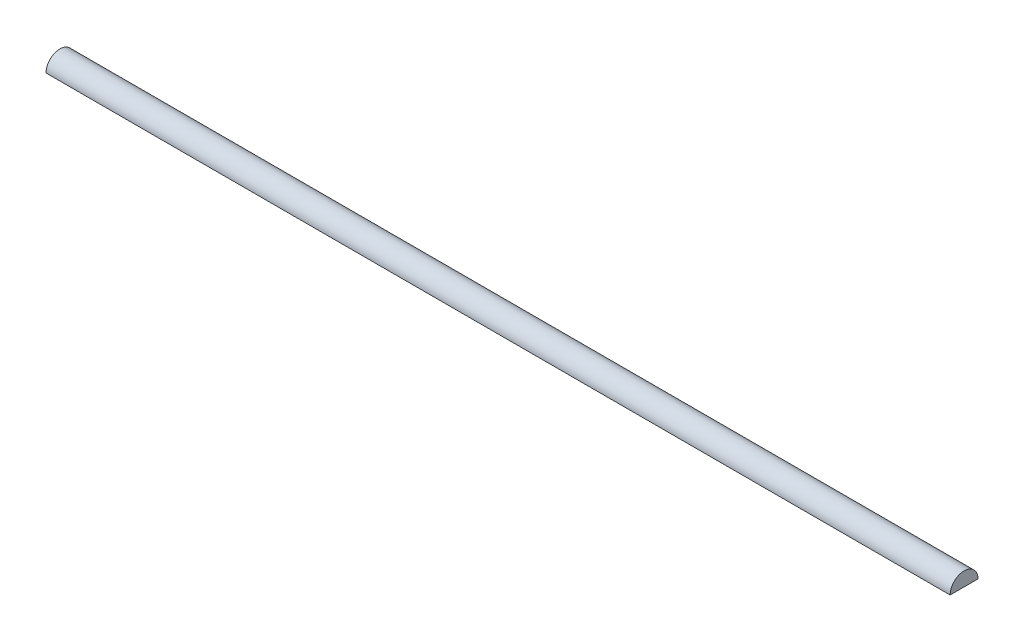
from build123d import *

# Parameters (mm, degrees)
BOSS_EXTRUDE1_DEPTH      = 40000
BOSS_EXTRUDE1_DEPTH_BACK = 40000
SKETCH2_R                = 1232.857562003
SKETCH3_W                = 80000
SKETCH3_H                = 3639.943339499
CUT_EXTRUDE1_DEPTH       = 40038.980412808


with BuildPart() as part:
    # Sketch1 → Revolve1 (revolve)
    with BuildSketch(Plane(origin=(0, 0, 0), x_dir=(-1, 0, 0), z_dir=(0, 1, 0))):
        Polygon((2034.243237694, 337.92), (227.58296711, 983.35), (5509.823784071, 1120), (9493.387900456, 1120), (10227.58296711, 1070), (8763.003370024, 1070), (8763.003370024, 0), (3247.519684342, 0), (3247.519684342, 368.69), align=None)
    revolve(axis=Axis((-3247.519684342, 0, 0), (-1, 0, 0)))


with BuildPart() as body_2:
    # Sketch2 → Boss-Extrude1 (new, two sides: drawn at the far end of the back side and taken through both)
    with BuildSketch(Plane(origin=(0, 0, 0), x_dir=(0, 0, -1), z_dir=(1, 0, 0)).offset(-BOSS_EXTRUDE1_DEPTH_BACK)):
        Circle(SKETCH2_R)
    extrude(amount=BOSS_EXTRUDE1_DEPTH + BOSS_EXTRUDE1_DEPTH_BACK)

    # Combine1: cut part
    add(part.part, mode=Mode.SUBTRACT)

    # Sketch3 → Cut-Extrude1 (cut, through all)
    with BuildSketch(Plane(origin=(0, 0, 0), x_dir=(-1, 0, 0), z_dir=(0, 1, 0))):
        with Locations((0, 260.380744392)):
            Rectangle(SKETCH3_W, SKETCH3_H)
    extrude(amount=-CUT_EXTRUDE1_DEPTH, mode=Mode.SUBTRACT)


solid = body_2.part
